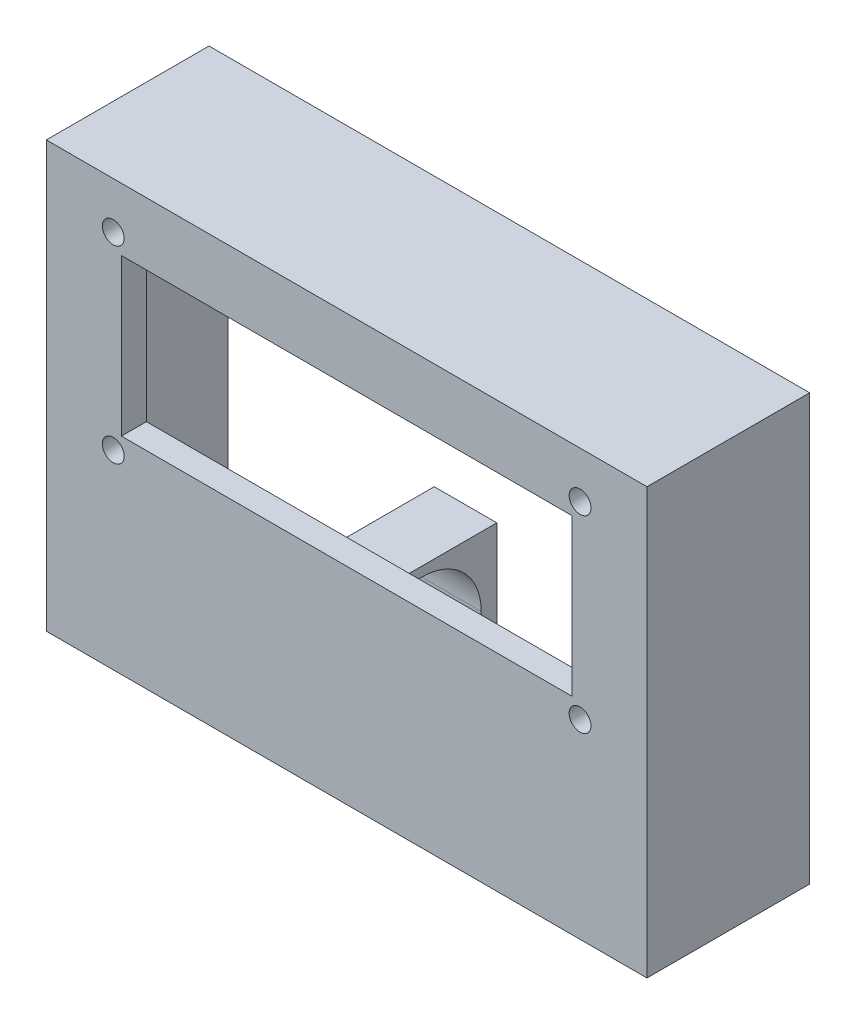
from build123d import *

# Parameters (mm, degrees)
ESQUISSE1_W             = 96
ESQUISSE1_H             = 68
ESQUISSE1_W_2           = 72
ESQUISSE1_H_2           = 25
BOSS_EXTRU_1_DEPTH      = 4
ESQUISSE2_R             = 1.75
ENL_V_MAT_EXTRU_1_DEPTH = 4
ESQUISSE3_W             = 10
ESQUISSE3_H             = 22
BOSS_EXTRU_2_DEPTH      = 22
ESQUISSE5_W             = 96
ESQUISSE5_H             = 68
ESQUISSE5_W_2           = 90
ESQUISSE5_H_2           = 62
BOSS_EXTRU_3_DEPTH      = 22
ENL_V_MAT_EXTRU_3_DEPTH = 54


with BuildPart() as part:
    # Esquisse1 → Boss.-Extru.1 (new body)
    with BuildSketch(Plane.XY):
        with Locations((48, -34)):
            Rectangle(ESQUISSE1_W, ESQUISSE1_H)
        with Locations((48, -22.5)):
            Rectangle(ESQUISSE1_W_2, ESQUISSE1_H_2, mode=Mode.SUBTRACT)
    extrude(amount=BOSS_EXTRU_1_DEPTH)

    # Esquisse2 → Enlèv. mat.-Extru.1 (cut)
    with BuildSketch(Plane.XY.offset(4)):
        with Locations((85.305, -7.42)):
            Circle(ESQUISSE2_R)
        with Locations((85.305, -37.58)):
            Circle(ESQUISSE2_R)
        with Locations((10.695, -37.58)):
            Circle(ESQUISSE2_R)
        with Locations((10.695, -7.42)):
            Circle(ESQUISSE2_R)
    extrude(amount=-ENL_V_MAT_EXTRU_1_DEPTH, mode=Mode.SUBTRACT)

    # Esquisse3 → Boss.-Extru.2 (add)
    with BuildSketch(Plane(origin=(0, 0, 0), x_dir=(-1, 0, 0), z_dir=(0, 0, -1))):
        with Locations((-81, -54)):
            Rectangle(ESQUISSE3_W, ESQUISSE3_H)
        with Locations((-41, -54)):
            Rectangle(ESQUISSE3_W, ESQUISSE3_H)
    extrude(amount=BOSS_EXTRU_2_DEPTH)

    # Esquisse5 → Boss.-Extru.3 (add)
    with BuildSketch(Plane(origin=(0, 0, 0), x_dir=(-1, 0, 0), z_dir=(0, 0, -1))):
        with Locations((-48, -34)):
            Rectangle(ESQUISSE5_W, ESQUISSE5_H)
        with Locations((-48, -34)):
            Rectangle(ESQUISSE5_W_2, ESQUISSE5_H_2, mode=Mode.SUBTRACT)
    extrude(amount=BOSS_EXTRU_3_DEPTH)

    # Esquisse4 → Enlèv. mat.-Extru.3 (cut)
    with BuildSketch(Plane(origin=(86, 0, 0), x_dir=(0, 0, -1), z_dir=(1, 0, 0))):
        with BuildLine():
            ThreePointArc((19.5, -54), (10, -44.5), (0.5, -54))
            Line((0.5, -54), (0.5, -65))
            Line((0.5, -65), (19.5, -65))
            Line((19.5, -65), (19.5, -54))
        make_face()
    extrude(amount=-ENL_V_MAT_EXTRU_3_DEPTH, mode=Mode.SUBTRACT)


solid = part.part
